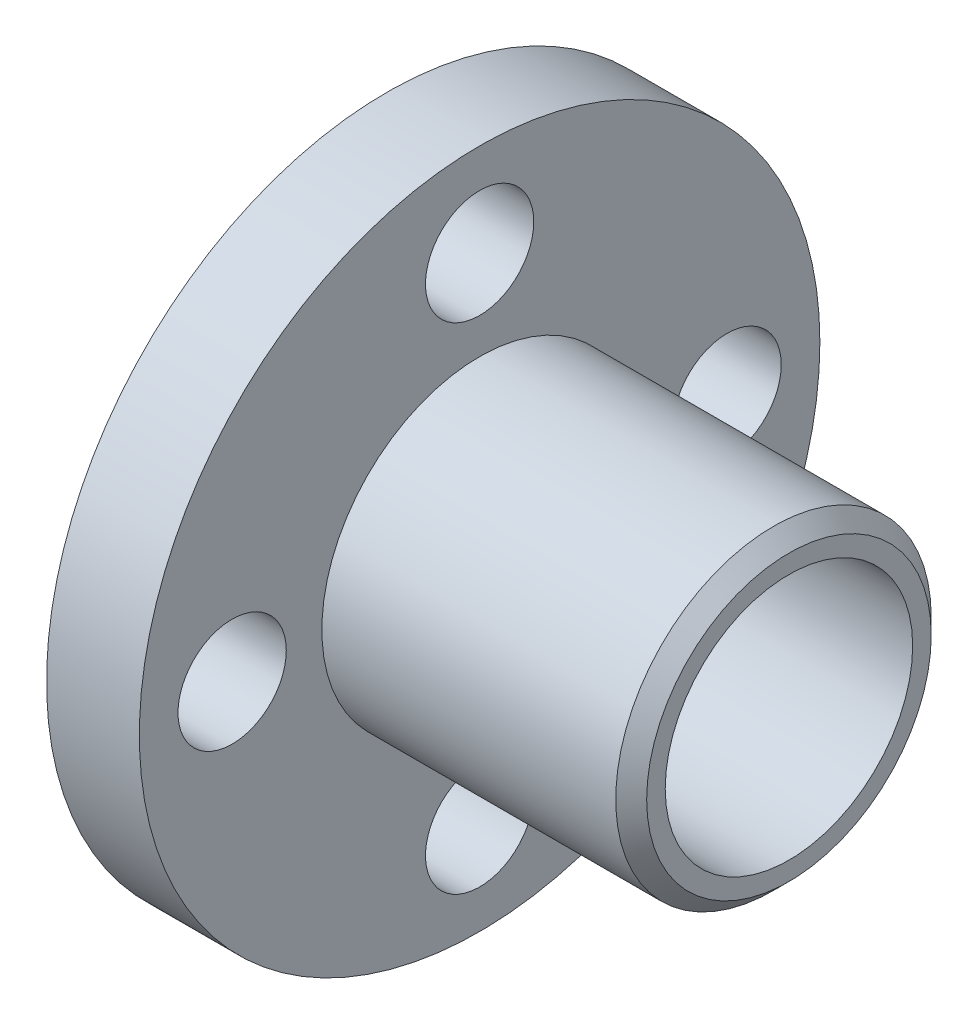
from build123d import *

# Parameters (mm, degrees)
CROQUIS1_R              = 11
CROQUIS1_R_2            = 1.75
SALIENTE_EXTRUIR1_DEPTH = 3
CROQUIS2_R              = 5.1
SALIENTE_EXTRUIR2_DEPTH = 10
CHAFL_N1_SIZE           = 0.5
SALIENTE_EXTRUIR3_START = 1.5
CROQUIS3_R              = 5.1
SALIENTE_EXTRUIR3_DEPTH = 1.5
CROQUIS4_R              = 4
CORTAR_EXTRUIR1_DEPTH   = 22.266170318


with BuildPart() as part:
    # Croquis1 → Saliente-Extruir1 (new body)
    with BuildSketch(Plane(origin=(0, 0, 0), x_dir=(0, 0, -1), z_dir=(1, 0, 0))):
        Circle(CROQUIS1_R)
        with Locations((0, 8)):
            Circle(CROQUIS1_R_2, mode=Mode.SUBTRACT)
        with Locations((8, 0)):
            Circle(CROQUIS1_R_2, mode=Mode.SUBTRACT)
        with Locations((0, -8)):
            Circle(CROQUIS1_R_2, mode=Mode.SUBTRACT)
        with Locations((-8, 0)):
            Circle(CROQUIS1_R_2, mode=Mode.SUBTRACT)
    extrude(amount=SALIENTE_EXTRUIR1_DEPTH)

    # Croquis2 → Saliente-Extruir2 (add)
    with BuildSketch(Plane(origin=(3, 0, 0), x_dir=(0, 0, -1), z_dir=(1, 0, 0))):
        Circle(CROQUIS2_R)
    extrude(amount=SALIENTE_EXTRUIR2_DEPTH)

    # Chaflán1
    chafl_n1_edges = [part.edges().sort_by_distance(p)[0] for p in [
        (13, 0, 5.1),
    ]]
    chamfer(chafl_n1_edges, length=CHAFL_N1_SIZE)

    # Croquis3 → Saliente-Extruir3 (add)
    with BuildSketch(Plane.ZY.offset(SALIENTE_EXTRUIR3_START)):
        Circle(CROQUIS3_R)
    extrude(amount=-SALIENTE_EXTRUIR3_DEPTH)

    # Croquis4 → Cortar-Extruir1 (cut, through all)
    with BuildSketch(Plane(origin=(13, 0, 0), x_dir=(0, 0, -1), z_dir=(1, 0, 0))):
        Circle(CROQUIS4_R)
    extrude(amount=-CORTAR_EXTRUIR1_DEPTH, mode=Mode.SUBTRACT)


solid = part.part
